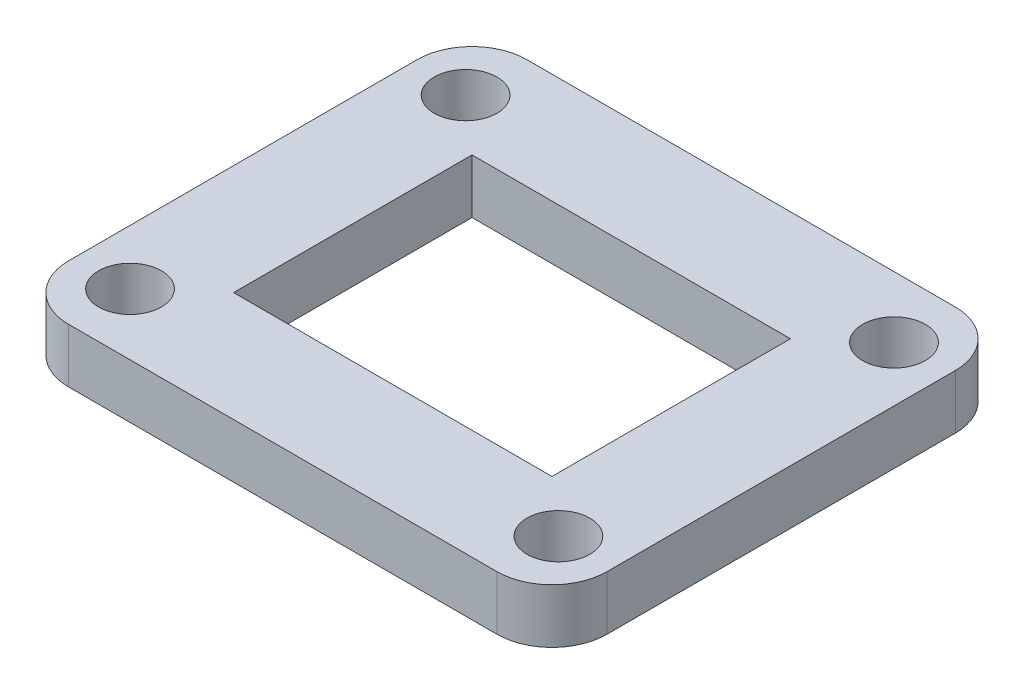
from build123d import *

# Parameters (mm, degrees)
SKETCH1_R           = 2.2
SKETCH1_W           = 22.3
SKETCH1_H           = 16.7
BOSS_EXTRUDE1_DEPTH = 3.8


with BuildPart() as part:
    # Sketch1 → Boss-Extrude1 (new body)
    with BuildSketch(Plane(origin=(0, 0, 0), x_dir=(1, 0, 0), z_dir=(0, 1, 0))):
        with BuildLine():
            Line((-15, -16.05), (15, -16.05))
            ThreePointArc((15, -16.05), (17.722361108, -14.922361108), (18.85, -12.2))
            Line((18.85, -12.2), (18.85, 12.2))
            ThreePointArc((18.85, 12.2), (17.722361108, 14.922361108), (15, 16.05))
            Line((15, 16.05), (-15, 16.05))
            ThreePointArc((-15, 16.05), (-17.722361108, 14.922361108), (-18.85, 12.2))
            Line((-18.85, 12.2), (-18.85, -12.2))
            ThreePointArc((-18.85, -12.2), (-17.722361108, -14.922361108), (-15, -16.05))
        make_face()
        with Locations((-15, 11.75)):
            Circle(SKETCH1_R, mode=Mode.SUBTRACT)
        with Locations((15, 11.75)):
            Circle(SKETCH1_R, mode=Mode.SUBTRACT)
        with Locations((15, -11.75)):
            Circle(SKETCH1_R, mode=Mode.SUBTRACT)
        with Locations((-15, -11.75)):
            Circle(SKETCH1_R, mode=Mode.SUBTRACT)
        Rectangle(SKETCH1_W, SKETCH1_H, mode=Mode.SUBTRACT)
    extrude(amount=BOSS_EXTRUDE1_DEPTH)


solid = part.part
